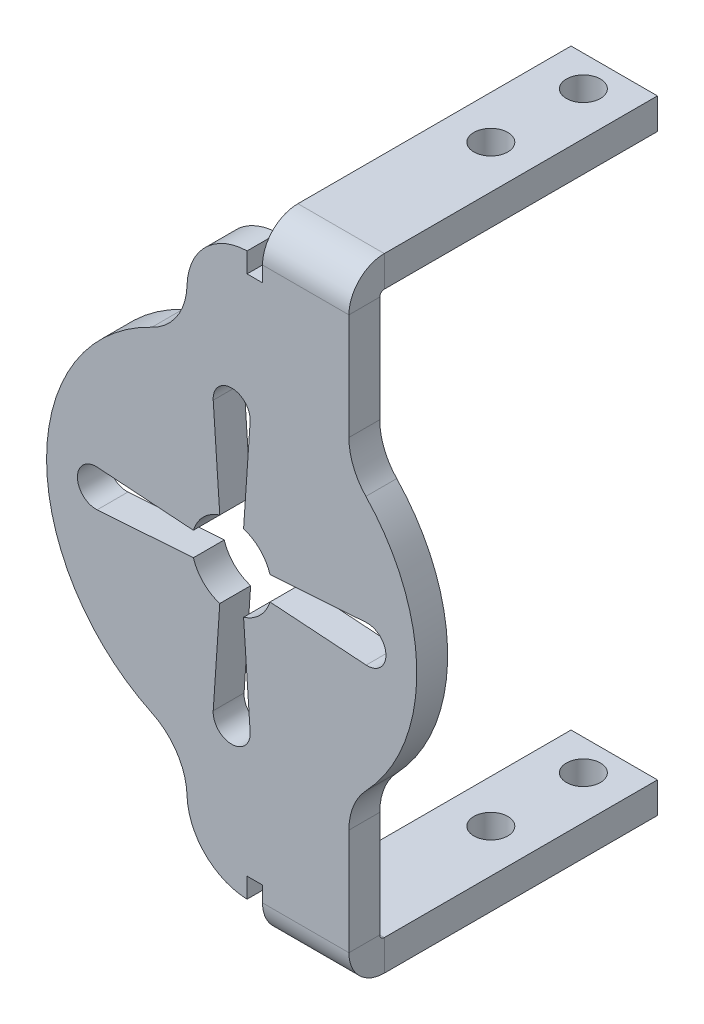
from build123d import *

# Parameters (mm, degrees)
SKETCH1_R                  = 6.5
BOSS_EXTRUDE1_DEPTH        = 5
SKETCH2_W                  = 14
SKETCH2_H                  = 5
BOSS_EXTRUDE2_DEPTH        = 50
SKETCH3_R                  = 2.75
CUT_EXTRUDE1_DEPTH         = 115
FILLET2_R                  = 10
CUT_EXTRUDE2_DEPTH         = 74.994932259
CIRPATTERN1_COUNT          = 4
BOSS_EXTRUDE5_START        = -5
BOSS_EXTRUDE5_DEPTH        = 5
FILLET5_R                  = 10
FILLET6_R                  = 10
FLATTEN_BENDS6_START       = -45
FLATTEN_BENDS6_OUTLINE_W   = 14
FLATTEN_BENDS6_OUTLINE_H   = 5
FLATTEN_BENDS6_DEPTH       = 45
FLATTEN_BENDS6_2_DEPTH     = 5
FLATTEN_BENDS6_3_OUTLINE_W = 14
FLATTEN_BENDS6_3_OUTLINE_H = 43.610839391
FLATTEN_BENDS6_3_OUTLINE_R = 2.75
FLATTEN_BENDS6_3_DEPTH     = 5
PROCESS_BENDS6_START       = -94.110839391
PROCESS_BENDS6_OUTLINE_W   = 14
PROCESS_BENDS6_OUTLINE_H   = 5
PROCESS_BENDS6_DEPTH       = 43.610839391
PROCESS_BENDS6_START_2     = 50.5
PROCESS_BENDS6_2_OUTLINE_W = 14
PROCESS_BENDS6_2_OUTLINE_H = 5
PROCESS_BENDS6_2_DEPTH     = 43.610839391
PROCESS_BENDS6_START_3     = -49.958579692
PROCESS_BENDS6_3_OUTLINE_W = 14
PROCESS_BENDS6_3_OUTLINE_H = 45
PROCESS_BENDS6_3_OUTLINE_R = 2.75
PROCESS_BENDS6_3_DEPTH     = 4.458579692
PROCESS_BENDS6_START_4     = 45.5
PROCESS_BENDS6_4_OUTLINE_W = 14
PROCESS_BENDS6_4_OUTLINE_H = 45
PROCESS_BENDS6_4_OUTLINE_R = 2.75
PROCESS_BENDS6_4_DEPTH     = 4.394100308
PROCESS_BENDS6_START_5     = 44.7634
PROCESS_BENDS6_5_OUTLINE_W = 14
PROCESS_BENDS6_5_OUTLINE_H = 45
PROCESS_BENDS6_5_OUTLINE_R = 2.75
PROCESS_BENDS6_5_DEPTH     = 5.7366
PROCESS_BENDS6_START_6     = -50.5
PROCESS_BENDS6_6_OUTLINE_W = 14
PROCESS_BENDS6_6_OUTLINE_H = 45
PROCESS_BENDS6_6_OUTLINE_R = 2.75
PROCESS_BENDS6_6_DEPTH     = 5.7366
PROCESS_BENDS6_START_7     = 5
PROCESS_BENDS6_7_DEPTH     = 14


with BuildPart() as part:
    # Sketch1 → Boss-Extrude1 (new body)
    with BuildSketch(Plane.XY):
        with BuildLine():
            Line((7.22970639, 29.115826375), (7.22970639, 45.5))
            Line((7.22970639, 45.5), (-7.22970639, 45.5))
            Line((-7.22970639, 45.5), (-7.22970639, 29.115826375))
            ThreePointArc((-7.22970639, 29.115826375), (-30, 0), (-7.22970639, -29.115826375))
            Line((-7.22970639, -29.115826375), (-7.22970639, -45.5))
            Line((-7.22970639, -45.5), (7.22970639, -45.5))
            Line((7.22970639, -45.5), (7.22970639, -29.115826375))
            ThreePointArc((7.22970639, -29.115826375), (30, 0), (7.22970639, 29.115826375))
        make_face()
        Circle(SKETCH1_R, mode=Mode.SUBTRACT)
    extrude(amount=BOSS_EXTRUDE1_DEPTH)

    # Sketch2 → Boss-Extrude2 (add)
    with BuildSketch(Plane.XY.offset(5)):
        with Locations((12, 48)):
            Rectangle(SKETCH2_W, SKETCH2_H)
        with Locations((12, -48)):
            Rectangle(SKETCH2_W, SKETCH2_H)
    extrude(amount=-BOSS_EXTRUDE2_DEPTH)

    # Sketch3 → Cut-Extrude1 (cut)
    with BuildSketch(Plane(origin=(0, 50.5, 0), x_dir=(1, 0, 0), z_dir=(0, 1, 0))):
        with Locations(Location((12, 40, 0), (0, 0, 270))):
            Circle(SKETCH3_R)
        with Locations(Location((12, 25, 0), (0, 0, 270))):
            Circle(SKETCH3_R)
    extrude(amount=-CUT_EXTRUDE1_DEPTH, mode=Mode.SUBTRACT)

    # Fillet2
    fillet2_edges = [part.edges().sort_by_distance(p)[0] for p in [
        (7.22970639, -29.115826375, 2.5),
        (-7.22970639, -29.115826375, 2.5),
        (-7.22970639, 29.115826375, 2.5),
        (7.22970639, 29.115826375, 2.5),
    ]]
    fillet(fillet2_edges, radius=FILLET2_R)

    # Sketch4 → Cut-Extrude2 (cut, through all)
    with BuildSketch(Plane(origin=(0, 0, 0), x_dir=(-1, 0, 0), z_dir=(0, 0, -1))):
        with BuildLine():
            Line((-2.993018736, 21.795454545), (-1.496509368, -0.102272727))
            ThreePointArc((-1.496509368, -0.102272727), (0, -1.5), (1.496509368, -0.102272727))
            Line((1.496509368, -0.102272727), (2.993018736, 21.795454545))
            ThreePointArc((2.993018736, 21.795454545), (0, 25), (-2.993018736, 21.795454545))
        make_face()
    cut_extrude2 = extrude(amount=-CUT_EXTRUDE2_DEPTH, mode=Mode.SUBTRACT)

    # CirPattern1: Cut-Extrude2 ×4 about axis
    cirpattern1_axis = Axis((0, 0, 0), (0, 0, 1))
    for i in range(1, CIRPATTERN1_COUNT):
        add(cut_extrude2.rotate(cirpattern1_axis, i * 360 / CIRPATTERN1_COUNT), mode=Mode.SUBTRACT)

    # Sketch41 → Boss-Extrude5 (add)
    with BuildSketch(Plane.XY.offset(5).offset(BOSS_EXTRUDE5_START)):
        with BuildLine():
            Line((7.22970639, 45.5), (19, 45.5))
            Line((19, 45.5), (19, 23.216373532))
            ThreePointArc((19, 23.216373532), (16.077275199, 25.32826923), (12.922279793, 27.074243941))
            ThreePointArc((12.922279793, 27.074243941), (8.771743693, 30.763931751), (7.22970639, 36.098991921))
            Line((7.22970639, 36.098991921), (7.22970639, 45.5))
        make_face()
        with BuildLine():
            Line((19, -45.5), (7.22970639, -45.5))
            Line((7.22970639, -45.5), (7.22970639, -36.098991921))
            ThreePointArc((7.22970639, -36.098991921), (8.771743693, -30.763931751), (12.922279793, -27.074243941))
            ThreePointArc((12.922279793, -27.074243941), (16.077275199, -25.32826923), (19, -23.216373532))
            Line((19, -23.216373532), (19, -45.5))
        make_face()
    extrude(amount=BOSS_EXTRUDE5_DEPTH)

    # Fillet5
    fillet5_edges = [part.edges().sort_by_distance(p)[0] for p in [
        (19, 23.216373532, 2.5),
        (19, -23.216373532, 2.5),
    ]]
    fillet(fillet5_edges, radius=FILLET5_R)

    # Fillet6
    fillet6_edges = [part.edges().sort_by_distance(p)[0] for p in [
        (-7.22970639, 45.5, 2.5),
        (-7.22970639, -45.5, 2.5),
    ]]
    fillet(fillet6_edges, radius=FILLET6_R)

    # Flatten-Bends6: read off the stored shape, not the designer's step
    # Flatten-Bends6 outline → Flatten-Bends6 (cut)
    with BuildSketch(Plane.XY.offset(FLATTEN_BENDS6_START)):
        with Locations((12, 48)):
            Rectangle(FLATTEN_BENDS6_OUTLINE_W, FLATTEN_BENDS6_OUTLINE_H)
        with Locations((12, -48)):
            Rectangle(FLATTEN_BENDS6_OUTLINE_W, FLATTEN_BENDS6_OUTLINE_H)
    extrude(amount=FLATTEN_BENDS6_DEPTH, mode=Mode.SUBTRACT)

    # Flatten-Bends6 2 outline → Flatten-Bends6 2 (cut)
    with BuildSketch(Plane.XY):
        with BuildLine():
            Line((5, 42.2634), (5, 45.5))
            Line((5, 45.5), (2.761321814, 45.5))
            ThreePointArc((2.761321814, 45.5), (2.63064975, 45.499146204), (2.5, 45.496584962))
            Line((2.5, 45.496584962), (2.5, 42.2634))
            Line((2.5, 42.2634), (5, 42.2634))
        make_face()
        with BuildLine():
            Line((5, -45.5), (5, -42.2634))
            Line((5, -42.2634), (2.5, -42.2634))
            Line((2.5, -42.2634), (2.5, -45.496584962))
            ThreePointArc((2.5, -45.496584962), (2.63064975, -45.499146204), (2.761321814, -45.5))
            Line((2.761321814, -45.5), (5, -45.5))
        make_face()
    extrude(amount=FLATTEN_BENDS6_2_DEPTH, mode=Mode.SUBTRACT)

    # Flatten-Bends6 3 outline → Flatten-Bends6 3 (add)
    # profile 1 of 2: a face of its own
    with BuildSketch(Plane.XY):
        with Locations((12, 72.305419696)):
            Rectangle(FLATTEN_BENDS6_3_OUTLINE_W, FLATTEN_BENDS6_3_OUTLINE_H)
        with Locations((12, 74.110839391)):
            Circle(FLATTEN_BENDS6_3_OUTLINE_R, mode=Mode.SUBTRACT)
        with Locations((12, 89.110839391)):
            Circle(FLATTEN_BENDS6_3_OUTLINE_R, mode=Mode.SUBTRACT)
    # profile 2 of 2: a face of its own
    with BuildSketch(Plane.XY):
        with Locations((12, -72.305419696)):
            Rectangle(FLATTEN_BENDS6_3_OUTLINE_W, FLATTEN_BENDS6_3_OUTLINE_H)
        with Locations((12, -89.110839391)):
            Circle(FLATTEN_BENDS6_3_OUTLINE_R, mode=Mode.SUBTRACT)
        with Locations((12, -74.110839391)):
            Circle(FLATTEN_BENDS6_3_OUTLINE_R, mode=Mode.SUBTRACT)
    extrude(amount=FLATTEN_BENDS6_3_DEPTH)

    # Process-Bends6: read off the stored shape, not the designer's step
    # Process-Bends6 outline → Process-Bends6 (cut)
    with BuildSketch(Plane(origin=(0, 0, 0), x_dir=(1, 0, 0), z_dir=(0, 1, 0)).offset(PROCESS_BENDS6_START)):
        with Locations((12, -2.5)):
            Rectangle(PROCESS_BENDS6_OUTLINE_W, PROCESS_BENDS6_OUTLINE_H)
    extrude(amount=PROCESS_BENDS6_DEPTH, mode=Mode.SUBTRACT)

    # Process-Bends6 2 outline → Process-Bends6 2 (cut)
    with BuildSketch(Plane(origin=(0, 0, 0), x_dir=(1, 0, 0), z_dir=(0, 1, 0)).offset(PROCESS_BENDS6_START_2)):
        with Locations((12, -2.5)):
            Rectangle(PROCESS_BENDS6_2_OUTLINE_W, PROCESS_BENDS6_2_OUTLINE_H)
    extrude(amount=PROCESS_BENDS6_2_DEPTH, mode=Mode.SUBTRACT)

    # Process-Bends6 3 outline → Process-Bends6 3 (add)
    with BuildSketch(Plane(origin=(0, 0, 0), x_dir=(1, 0, 0), z_dir=(0, 1, 0)).offset(PROCESS_BENDS6_START_3)):
        with Locations((12, 22.5)):
            Rectangle(PROCESS_BENDS6_3_OUTLINE_W, PROCESS_BENDS6_3_OUTLINE_H)
        with Locations((12, 25)):
            Circle(PROCESS_BENDS6_3_OUTLINE_R, mode=Mode.SUBTRACT)
        with Locations((12, 40)):
            Circle(PROCESS_BENDS6_3_OUTLINE_R, mode=Mode.SUBTRACT)
    extrude(amount=PROCESS_BENDS6_3_DEPTH)

    # Process-Bends6 4 outline → Process-Bends6 4 (add)
    with BuildSketch(Plane(origin=(0, 0, 0), x_dir=(1, 0, 0), z_dir=(0, 1, 0)).offset(PROCESS_BENDS6_START_4)):
        with Locations((12, 22.5)):
            Rectangle(PROCESS_BENDS6_4_OUTLINE_W, PROCESS_BENDS6_4_OUTLINE_H)
        with Locations((12, 25)):
            Circle(PROCESS_BENDS6_4_OUTLINE_R, mode=Mode.SUBTRACT)
        with Locations((12, 40)):
            Circle(PROCESS_BENDS6_4_OUTLINE_R, mode=Mode.SUBTRACT)
    extrude(amount=PROCESS_BENDS6_4_DEPTH)

    # Process-Bends6 5 outline → Process-Bends6 5 (add)
    with BuildSketch(Plane(origin=(0, 0, 0), x_dir=(1, 0, 0), z_dir=(0, 1, 0)).offset(PROCESS_BENDS6_START_5)):
        with Locations((12, 22.5)):
            Rectangle(PROCESS_BENDS6_5_OUTLINE_W, PROCESS_BENDS6_5_OUTLINE_H)
        with Locations((12, 25)):
            Circle(PROCESS_BENDS6_5_OUTLINE_R, mode=Mode.SUBTRACT)
        with Locations((12, 40)):
            Circle(PROCESS_BENDS6_5_OUTLINE_R, mode=Mode.SUBTRACT)
    extrude(amount=PROCESS_BENDS6_5_DEPTH)

    # Process-Bends6 6 outline → Process-Bends6 6 (add)
    with BuildSketch(Plane(origin=(0, 0, 0), x_dir=(1, 0, 0), z_dir=(0, 1, 0)).offset(PROCESS_BENDS6_START_6)):
        with Locations((12, 22.5)):
            Rectangle(PROCESS_BENDS6_6_OUTLINE_W, PROCESS_BENDS6_6_OUTLINE_H)
        with Locations((12, 25)):
            Circle(PROCESS_BENDS6_6_OUTLINE_R, mode=Mode.SUBTRACT)
        with Locations((12, 40)):
            Circle(PROCESS_BENDS6_6_OUTLINE_R, mode=Mode.SUBTRACT)
    extrude(amount=PROCESS_BENDS6_6_DEPTH)

    # Process-Bends6 7 outline → Process-Bends6 7 (cut)
    with BuildSketch(Plane.YZ.offset(PROCESS_BENDS6_START_7)):
        with BuildLine():
            Line((-45.5, -0.7366), (-45.5, -45))
            Line((-45.5, -45), (-44.7634, -45))
            Line((-44.7634, -45), (-44.7634, 0))
            ThreePointArc((-44.7634, 0), (-45.284254855, -0.215745145), (-45.5, -0.7366))
        make_face()
        with BuildLine():
            ThreePointArc((-50.5, -0.7366), (-48.819788761, 3.319788761), (-44.7634, 5))
            Line((-44.7634, 5), (-50.5, 5))
            Line((-50.5, 5), (-50.5, -0.7366))
        make_face()
        with BuildLine():
            ThreePointArc((44.7634, 5), (48.819788761, 3.319788761), (50.5, -0.7366))
            Line((50.5, -0.7366), (50.5, 5))
            Line((50.5, 5), (44.7634, 5))
        make_face()
        with BuildLine():
            Line((45.5, -45), (45.5, -0.7366))
            ThreePointArc((45.5, -0.7366), (45.284254855, -0.215745145), (44.7634, 0))
            Line((44.7634, 0), (44.7634, -45))
            Line((44.7634, -45), (45.5, -45))
        make_face()
    extrude(amount=PROCESS_BENDS6_7_DEPTH, mode=Mode.SUBTRACT)


solid = part.part
